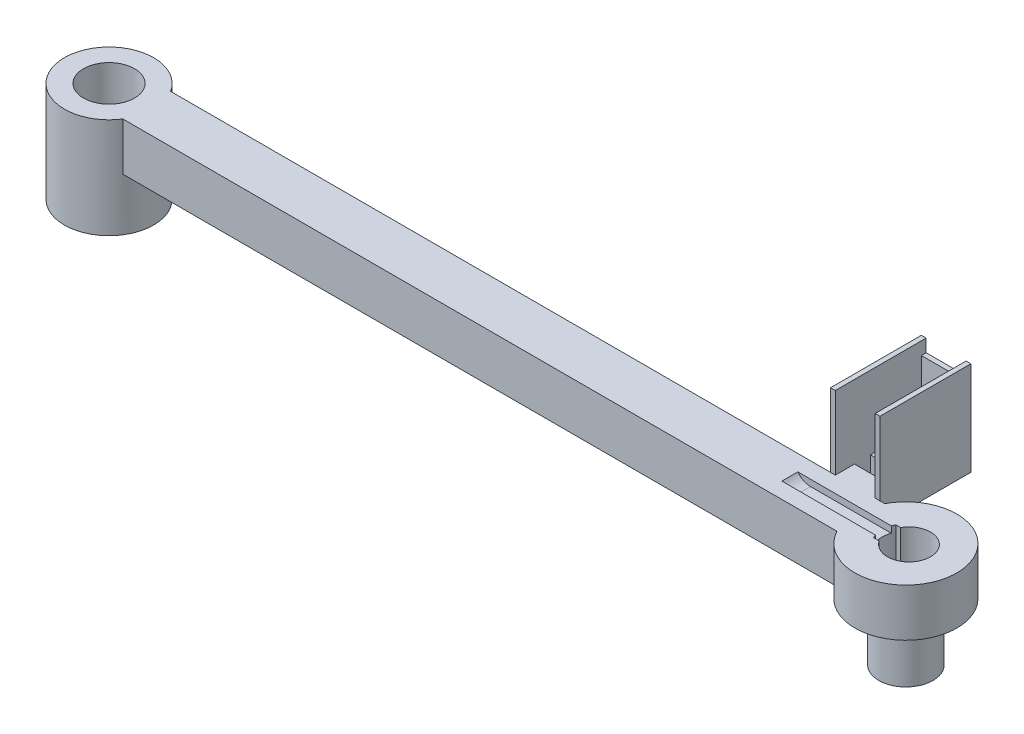
from build123d import *

# Parameters (mm, degrees)
BOSS_EXTRUDE7_DEPTH                   = 15
BOSS_EXTRUDE7_DEPTH_BACK              = 16.5
SKETCH2_R                             = 14
SKETCH2_R_2                           = 8
SKETCH2_9_R                           = 16
BOSS_EXTRUDE8_DEPTH                   = 15
BOSS_EXTRUDE11_REACH                  = 219.48
BOSS_EXTRUDE11_END_RADIUS             = 14
BOSS_EXTRUDE11_DIRECTION_2_REACH      = 219.48
BOSS_EXTRUDE11_DIRECTION_2_END_RADIUS = 16
BOSS_EXTRUDE12_REACH                  = 219.597
SKETCH15_W                            = 3
SKETCH15_H                            = 9.5
FILLET1_R                             = 2
BOSS_EXTRUDE13_START                  = -4
SKETCH2_13_R                          = 8
SKETCH2_13_R_2                        = 4.25
BOSS_EXTRUDE13_DEPTH                  = 12.5
SKETCH2_14_R                          = 8.5
BOSS_EXTRUDE14_DEPTH                  = 18
SKETCH16_W                            = 30
SKETCH16_H                            = 5
CUT_EXTRUDE1_DEPTH                    = 2
FILLET2_R                             = 5
SKETCH18_W                            = 1.5
SKETCH18_H                            = 23
BOSS_EXTRUDE15_DEPTH                  = 28.5
SKETCH18_3_W                          = 12.5
SKETCH18_3_H                          = 5
BOSS_EXTRUDE16_DEPTH                  = 6
SKETCH19_W                            = 12.5
SKETCH19_H                            = 1.5
BOSS_EXTRUDE17_DEPTH                  = 24
SKETCH20_W                            = 12.5
SKETCH20_H                            = 16
BOSS_EXTRUDE18_DEPTH                  = 5


with BuildPart() as part:
    # Sketch2 → Boss-Extrude7 (new, two sides: drawn at the far end of the back side and taken through both)
    with BuildSketch(Plane(origin=(0, 0, 0), x_dir=(1, 0, 0), z_dir=(0, 1, 0)).offset(-BOSS_EXTRUDE7_DEPTH_BACK)):
        with Locations(Location((-50, 3.220631283, 0), (0, 0, 270))):
            Circle(SKETCH2_R)
        with Locations(Location((-50, 3.220631283, 0), (0, 0, 270))):
            Circle(SKETCH2_R_2, mode=Mode.SUBTRACT)
    extrude(amount=BOSS_EXTRUDE7_DEPTH + BOSS_EXTRUDE7_DEPTH_BACK)


with BuildPart() as body_2:
    # Sketch2<9> → Boss-Extrude8 (new body)
    with BuildSketch(Plane(origin=(0, 0, 0), x_dir=(1, 0, 0), z_dir=(0, 1, 0))):
        with Locations(Location((200, 3.22063128, 0), (0, 0, 270))):
            Circle(SKETCH2_9_R)
        with BuildLine():
            Line((193.366750419, 6.72063128), (194.847605266, 6.72063128))
            ThreePointArc((194.847605266, 6.72063128), (207.494856499, 3.709302606), (195.121030689, -0.27936872))
            Line((195.121030689, -0.27936872), (193.366750419, -0.27936872))
            ThreePointArc((193.366750419, -0.27936872), (192.5, 3.22063128), (193.366750419, 6.72063128))
        make_face(mode=Mode.SUBTRACT)
    extrude(amount=BOSS_EXTRUDE8_DEPTH)


    add(part.part)  # Boss-Extrude11 merges part
    # Boss-Extrude11: up to this cylinder (the profile starts outside it)
    boss_extrude11_end = Plane(origin=(-50, 6, -3.220631283), z_dir=(0, 1, 0)) * Cylinder(BOSS_EXTRUDE11_END_RADIUS, 467.96, mode=Mode.PRIVATE)
    # Sketch3 → Boss-Extrude11 (add, up to the surface)
    with BuildSketch(Plane(origin=(0, 0, 0), x_dir=(0, 0, -1), z_dir=(1, 0, 0)), mode=Mode.PRIVATE) as boss_extrude11_sk1:
        Polygon((10.720631283, 0), (10.720631283, 15), (-4.279368717, 15), (-4.279368717, 0), (-1.279368717, 0), (-1.279368717, 12), (7.720631283, 12), (7.720631283, 0), align=None)
    boss_extrude11_tool1 = extrude(boss_extrude11_sk1.sketch, amount=-BOSS_EXTRUDE11_REACH, mode=Mode.PRIVATE) - boss_extrude11_end
    add(boss_extrude11_tool1.solids().sort_by_distance((0, 6, 1.491501))[0])

    # Boss-Extrude11 direction 2: up to this cylinder (the profile starts outside it)
    boss_extrude11_direction_2_end = Plane(origin=(200, 6, -3.22063128), z_dir=(0, -1, 0)) * Cylinder(BOSS_EXTRUDE11_DIRECTION_2_END_RADIUS, 471.96, mode=Mode.PRIVATE)
    # Sketch3 → Boss-Extrude11 direction 2 (add, up to the surface)
    with BuildSketch(Plane(origin=(0, 0, 0), x_dir=(0, 0, -1), z_dir=(1, 0, 0)), mode=Mode.PRIVATE) as boss_extrude11_direction_2_sk1:
        Polygon((10.720631283, 0), (10.720631283, 15), (-4.279368717, 15), (-4.279368717, 0), (-1.279368717, 0), (-1.279368717, 12), (7.720631283, 12), (7.720631283, 0), align=None)
    boss_extrude11_direction_2_tool1 = extrude(boss_extrude11_direction_2_sk1.sketch, amount=BOSS_EXTRUDE11_DIRECTION_2_REACH, mode=Mode.PRIVATE) - boss_extrude11_direction_2_end
    add(boss_extrude11_direction_2_tool1.solids().sort_by_distance((0, 6, 1.491501))[0])

    # Sketch15 → Boss-Extrude12 (add, up to next)
    with BuildSketch(Plane.XY.offset(-7.720631283), mode=Mode.PRIVATE) as boss_extrude12_sk1:
        with Locations((-14.45117452, 7.25)):
            Rectangle(SKETCH15_W, SKETCH15_H)
    boss_extrude12_tool1 = extrude(boss_extrude12_sk1.sketch, amount=BOSS_EXTRUDE12_REACH, mode=Mode.PRIVATE) - body_2.part
    # Sketch15 → Boss-Extrude12 (add, up to next)
    with BuildSketch(Plane.XY.offset(-7.720631283), mode=Mode.PRIVATE) as boss_extrude12_sk2:
        with Locations((86.457765729, 7.25)):
            Rectangle(SKETCH15_W, SKETCH15_H)
    boss_extrude12_tool2 = extrude(boss_extrude12_sk2.sketch, amount=BOSS_EXTRUDE12_REACH, mode=Mode.PRIVATE) - body_2.part
    # Sketch15 → Boss-Extrude12 (add, up to next)
    with BuildSketch(Plane.XY.offset(-7.720631283), mode=Mode.PRIVATE) as boss_extrude12_sk3:
        with Locations((10.776060542, 7.25)):
            Rectangle(SKETCH15_W, SKETCH15_H)
    boss_extrude12_tool3 = extrude(boss_extrude12_sk3.sketch, amount=BOSS_EXTRUDE12_REACH, mode=Mode.PRIVATE) - body_2.part
    # Sketch15 → Boss-Extrude12 (add, up to next)
    with BuildSketch(Plane.XY.offset(-7.720631283), mode=Mode.PRIVATE) as boss_extrude12_sk4:
        with Locations((36.003295604, 7.25)):
            Rectangle(SKETCH15_W, SKETCH15_H)
    boss_extrude12_tool4 = extrude(boss_extrude12_sk4.sketch, amount=BOSS_EXTRUDE12_REACH, mode=Mode.PRIVATE) - body_2.part
    # Sketch15 → Boss-Extrude12 (add, up to next)
    with BuildSketch(Plane.XY.offset(-7.720631283), mode=Mode.PRIVATE) as boss_extrude12_sk5:
        with Locations((61.230530666, 7.25)):
            Rectangle(SKETCH15_W, SKETCH15_H)
    boss_extrude12_tool5 = extrude(boss_extrude12_sk5.sketch, amount=BOSS_EXTRUDE12_REACH, mode=Mode.PRIVATE) - body_2.part
    # Sketch15 → Boss-Extrude12 (add, up to next)
    with BuildSketch(Plane.XY.offset(-7.720631283), mode=Mode.PRIVATE) as boss_extrude12_sk6:
        with Locations((111.685000791, 7.25)):
            Rectangle(SKETCH15_W, SKETCH15_H)
    boss_extrude12_tool6 = extrude(boss_extrude12_sk6.sketch, amount=BOSS_EXTRUDE12_REACH, mode=Mode.PRIVATE) - body_2.part
    # Sketch15 → Boss-Extrude12 (add, up to next)
    with BuildSketch(Plane.XY.offset(-7.720631283), mode=Mode.PRIVATE) as boss_extrude12_sk7:
        with Locations((136.912235853, 7.25)):
            Rectangle(SKETCH15_W, SKETCH15_H)
    boss_extrude12_tool7 = extrude(boss_extrude12_sk7.sketch, amount=BOSS_EXTRUDE12_REACH, mode=Mode.PRIVATE) - body_2.part
    # Sketch15 → Boss-Extrude12 (add, up to next)
    with BuildSketch(Plane.XY.offset(-7.720631283), mode=Mode.PRIVATE) as boss_extrude12_sk8:
        with Locations((162.139470915, 7.25)):
            Rectangle(SKETCH15_W, SKETCH15_H)
    boss_extrude12_tool8 = extrude(boss_extrude12_sk8.sketch, amount=BOSS_EXTRUDE12_REACH, mode=Mode.PRIVATE) - body_2.part
    add(boss_extrude12_tool1.solids().sort_by_distance((-14.451175, 7.25, -7.720631))[0])
    add(boss_extrude12_tool2.solids().sort_by_distance((86.457766, 7.25, -7.720631))[0])
    add(boss_extrude12_tool3.solids().sort_by_distance((10.776061, 7.25, -7.720631))[0])
    add(boss_extrude12_tool4.solids().sort_by_distance((36.003296, 7.25, -7.720631))[0])
    add(boss_extrude12_tool5.solids().sort_by_distance((61.230531, 7.25, -7.720631))[0])
    add(boss_extrude12_tool6.solids().sort_by_distance((111.685001, 7.25, -7.720631))[0])
    add(boss_extrude12_tool7.solids().sort_by_distance((136.912236, 7.25, -7.720631))[0])
    add(boss_extrude12_tool8.solids().sort_by_distance((162.139471, 7.25, -7.720631))[0])

    # Fillet1
    fillet1_edges = [body_2.edges().sort_by_distance(p)[0] for p in [
        (59.730530666, 7.25, 1.279368717),
        (62.730530666, 7.25, 1.279368717),
        (62.730530666, 7.25, -7.720631283),
        (59.730530666, 7.25, -7.720631283),
        (110.185000791, 7.25, 1.279368717),
        (113.185000791, 7.25, 1.279368717),
        (113.185000791, 7.25, -7.720631283),
        (110.185000791, 7.25, -7.720631283),
        (135.412235853, 7.25, 1.279368717),
        (138.412235853, 7.25, 1.279368717),
        (138.412235853, 7.25, -7.720631283),
        (135.412235853, 7.25, -7.720631283),
        (160.639470915, 7.25, 1.279368717),
        (163.639470915, 7.25, 1.279368717),
        (163.639470915, 7.25, -7.720631283),
        (160.639470915, 7.25, -7.720631283),
        (-15.95117452, 7.25, 1.279368717),
        (-12.95117452, 7.25, 1.279368717),
        (-12.95117452, 7.25, -7.720631283),
        (-15.95117452, 7.25, -7.720631283),
        (84.957765729, 7.25, 1.279368717),
        (87.957765729, 7.25, 1.279368717),
        (87.957765729, 7.25, -7.720631283),
        (84.957765729, 7.25, -7.720631283),
        (12.276060542, 7.25, 1.279368717),
        (9.276060542, 7.25, 1.279368717),
        (12.276060542, 7.25, -7.720631283),
        (9.276060542, 7.25, -7.720631283),
        (34.503295604, 7.25, 1.279368717),
        (37.503295604, 7.25, 1.279368717),
        (37.503295604, 7.25, -7.720631283),
        (34.503295604, 7.25, -7.720631283),
    ]]
    fillet(fillet1_edges, radius=FILLET1_R)

    # Sketch2<13> → Boss-Extrude13 (add, through all)
    with BuildSketch(Plane(origin=(0, 0, 0), x_dir=(1, 0, 0), z_dir=(0, 1, 0)).offset(BOSS_EXTRUDE13_START)):
        with Locations(Location((-50, 3.220631283, 0), (0, 0, 270))):
            Circle(SKETCH2_13_R)
        with Locations(Location((-50, 3.220631283, 0), (0, 0, 270))):
            Circle(SKETCH2_13_R_2, mode=Mode.SUBTRACT)
    extrude(amount=-BOSS_EXTRUDE13_DEPTH)

    # Sketch16 → Cut-Extrude1 (cut)
    with BuildSketch(Plane(origin=(0, 15, 0), x_dir=(1, 0, 0), z_dir=(0, 1, 0))):
        with Locations((178.595378821, 3.22063128)):
            Rectangle(SKETCH16_W, SKETCH16_H)
    extrude(amount=-CUT_EXTRUDE1_DEPTH, mode=Mode.SUBTRACT)

    # Fillet2
    # the kernel refuses this fillet: 5 mm, written as the material it adds along each edge
    with BuildSketch(Plane(origin=(163.595378821, 13, -0.72063128), x_dir=(0, 1, 0), z_dir=(0, 0, -1))) as fillet2_piece_1:
        with BuildLine():
            CenterArc((5, 4), FILLET2_R, 180, 53.130102354)
            Line((0, 4), (0, 0))
            Line((0, 0), (2, 0))
        make_face()
    extrude(amount=5)

    # Sketch18 → Boss-Extrude15 (add)
    with BuildSketch(Plane(origin=(0, 0, -10.720631283), x_dir=(-1, 0, 0), z_dir=(0, 0, -1))):
        with Locations((-183.616705977, 26.5)):
            Rectangle(SKETCH18_W, SKETCH18_H)
        Polygon((-184.366705977, 15), (-184.366705977, 8.5), (-168.866705977, 8.5), (-168.866705977, 15), (-170.366705977, 15), (-170.366705977, 10), (-182.866705977, 10), (-182.866705977, 15), align=None)
        with Locations((-169.616705977, 26.5)):
            Rectangle(SKETCH18_W, SKETCH18_H)
    extrude(amount=BOSS_EXTRUDE15_DEPTH)

    # Sketch18<3> → Boss-Extrude16 (add)
    with BuildSketch(Plane(origin=(0, 0, -10.720631283), x_dir=(-1, 0, 0), z_dir=(0, 0, -1))):
        with Locations((-176.616705977, 12.5)):
            Rectangle(SKETCH18_3_W, SKETCH18_3_H)
    extrude(amount=BOSS_EXTRUDE16_DEPTH)

    # Sketch19 → Boss-Extrude17 (add)
    with BuildSketch(Plane(origin=(0, 10, 0), x_dir=(1, 0, 0), z_dir=(0, 1, 0))):
        with Locations((176.616705977, 38.470631283)):
            Rectangle(SKETCH19_W, SKETCH19_H)
    extrude(amount=BOSS_EXTRUDE17_DEPTH)

    # Sketch20 → Boss-Extrude18 (add)
    with BuildSketch(Plane(origin=(0, 10, 0), x_dir=(1, 0, 0), z_dir=(0, 1, 0))):
        with Locations((176.616705977, 29.720631283)):
            Rectangle(SKETCH20_W, SKETCH20_H)
    extrude(amount=BOSS_EXTRUDE18_DEPTH)


with BuildPart() as body_2_2:
    # Sketch2<14> → Boss-Extrude14 (new body)
    with BuildSketch(Plane(origin=(0, 0, 0), x_dir=(1, 0, 0), z_dir=(0, 1, 0))):
        with Locations(Location((200, 3.22063128, 0), (0, 0, 270))):
            Circle(SKETCH2_14_R)
        with BuildLine():
            Line((193.366750419, 6.72063128), (194.847605266, 6.72063128))
            ThreePointArc((194.847605266, 6.72063128), (207.494856499, 3.709302606), (195.121030689, -0.27936872))
            Line((195.121030689, -0.27936872), (193.366750419, -0.27936872))
            ThreePointArc((193.366750419, -0.27936872), (192.5, 3.22063128), (193.366750419, 6.72063128))
        make_face(mode=Mode.SUBTRACT)
    extrude(amount=-BOSS_EXTRUDE14_DEPTH)


solid = Compound([body_2.part, body_2_2.part])
